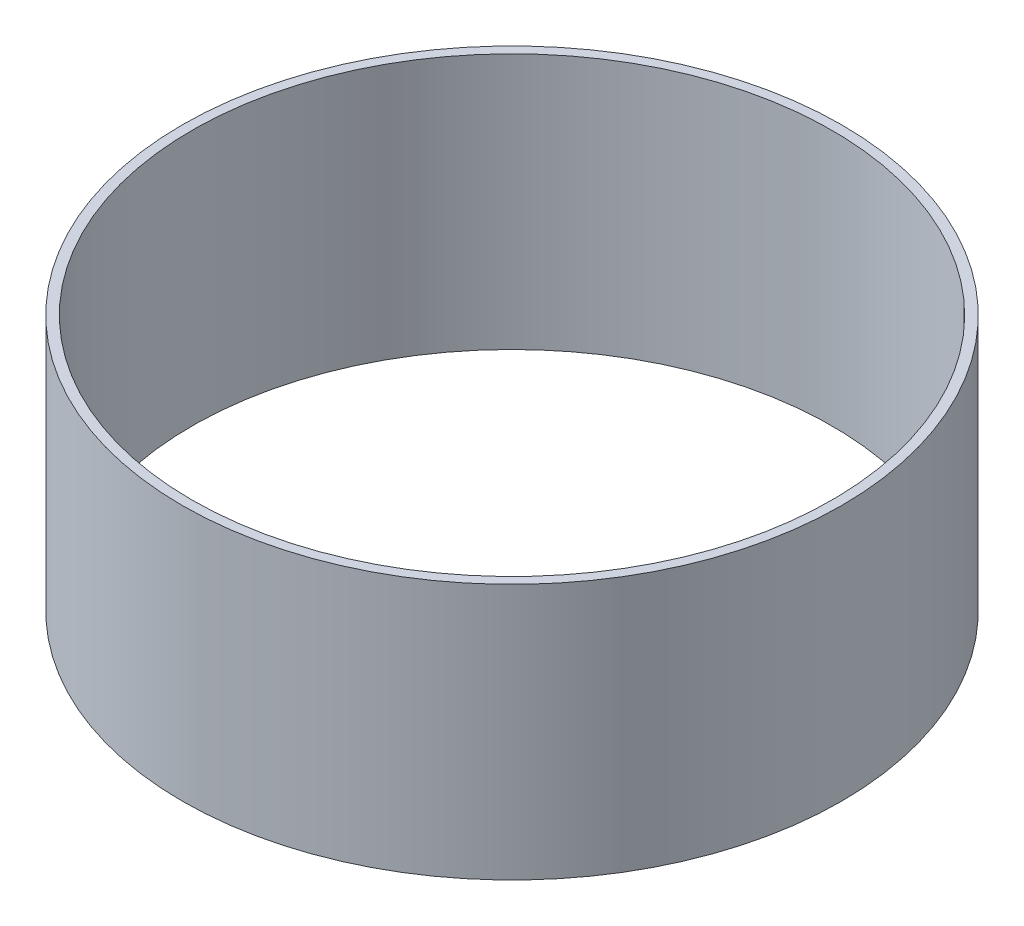
from build123d import *

# Parameters (mm, degrees)
SKETCH1_R           = 65.405
SKETCH1_R_2         = 63.5
BOSS_EXTRUDE1_DEPTH = 25.4


with BuildPart() as part:
    # Sketch1 → Boss-Extrude1 (new, symmetric)
    with BuildSketch(Plane(origin=(0, 0, 0), x_dir=(1, 0, 0), z_dir=(0, 1, 0))):
        Circle(SKETCH1_R)
        Circle(SKETCH1_R_2, mode=Mode.SUBTRACT)
    extrude(amount=BOSS_EXTRUDE1_DEPTH, both=True)


solid = part.part
